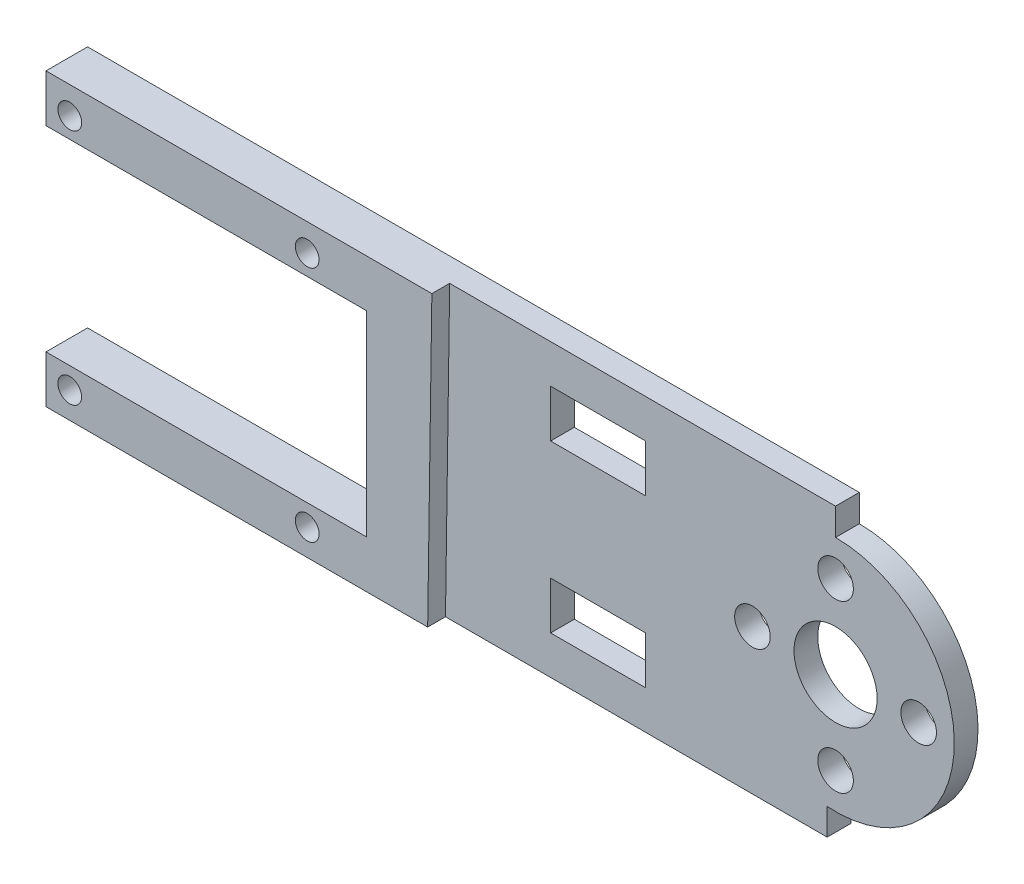
from build123d import *

# Parameters (mm, degrees)
SKETCH1_R           = 1.5
SKETCH1_R_2         = 3.5
SKETCH1_R_3         = 1
SKETCH1_W           = 8
SKETCH1_H           = 4
BOSS_EXTRUDE1_DEPTH = 2
BOSS_EXTRUDE2_DEPTH = 1.5
SKETCH4_R           = 1
CUT_EXTRUDE1_DEPTH  = 52.758903682


with BuildPart() as part:
    # Sketch1 → Boss-Extrude1 (new body)
    with BuildSketch(Plane.XY):
        with BuildLine():
            Line((-4.833560916, 12.25), (5.166439084, 12.25))
            Line((5.166439084, 12.25), (40.166439084, 12.25))
            Line((40.166439084, 12.25), (40.166439084, 9.964216866))
            ThreePointArc((40.166439084, 9.964216866), (50.16018383, -0.389429797), (39.459588189, -10.010769942))
            Line((39.459588189, -10.010769942), (39.459588189, -12.25))
            Line((39.459588189, -12.25), (5.166439084, -12.25))
            Line((5.166439084, -12.25), (-4.833560916, -12.25))
            Line((-4.833560916, -12.25), (-24.833560916, -12.25))
            Line((-24.833560916, -12.25), (-24.833560916, -8.25))
            Line((-24.833560916, -8.25), (2.166439084, -8.25))
            Line((2.166439084, -8.25), (2.166439084, 8.25))
            Line((2.166439084, 8.25), (-24.833560916, 8.25))
            Line((-24.833560916, 8.25), (-24.833560916, 12.25))
            Line((-24.833560916, 12.25), (-4.833560916, 12.25))
        make_face()
        with Locations((40.166439084, 6.964216866)):
            Circle(SKETCH1_R, mode=Mode.SUBTRACT)
        with Locations((47.166439084, -0.035783134)):
            Circle(SKETCH1_R, mode=Mode.SUBTRACT)
        with Locations((40.166439084, -7.035783134)):
            Circle(SKETCH1_R, mode=Mode.SUBTRACT)
        with Locations((33.166439084, -0.035783134)):
            Circle(SKETCH1_R, mode=Mode.SUBTRACT)
        with Locations((40.166439084, -0.035783134)):
            Circle(SKETCH1_R_2, mode=Mode.SUBTRACT)
        with Locations((-2.833560916, 9.964216866)):
            Circle(SKETCH1_R_3, mode=Mode.SUBTRACT)
        with Locations((-2.833560916, -10.035783134)):
            Circle(SKETCH1_R_3, mode=Mode.SUBTRACT)
        with Locations((-22.833560916, 9.964216866)):
            Circle(SKETCH1_R_3, mode=Mode.SUBTRACT)
        with Locations((-22.833560916, -10.035783134)):
            Circle(SKETCH1_R_3, mode=Mode.SUBTRACT)
        with Locations((20.166471095, 7)):
            Rectangle(SKETCH1_W, SKETCH1_H, mode=Mode.SUBTRACT)
        with Locations((20.166471095, -7)):
            Rectangle(SKETCH1_W, SKETCH1_H, mode=Mode.SUBTRACT)
    extrude(amount=BOSS_EXTRUDE1_DEPTH)

    # Sketch2 → Boss-Extrude2 (add)
    with BuildSketch(Plane.XY.offset(2)):
        Polygon((-24.833560916, 12.25), (7.666439084, 12.25), (7.313013637, -12.25), (-24.833560916, -12.25), (-24.833560916, -8.25), (2.166439084, -8.25), (2.166439084, 8.25), (-24.833560916, 8.25), align=None)
    extrude(amount=BOSS_EXTRUDE2_DEPTH)

    # Sketch4 → Cut-Extrude1 (cut, through all)
    with BuildSketch(Plane(origin=(0, 0, 0), x_dir=(-1, 0, 0), z_dir=(0, 0, -1))):
        with Locations((2.833560916, 9.964216866)):
            Circle(SKETCH4_R)
        with Locations((2.833560916, -10.035783134)):
            Circle(SKETCH4_R)
        with Locations((22.833560916, -10.035783134)):
            Circle(SKETCH4_R)
        with Locations((22.833560916, 9.964216866)):
            Circle(SKETCH4_R)
    extrude(amount=-CUT_EXTRUDE1_DEPTH, mode=Mode.SUBTRACT)


solid = part.part
